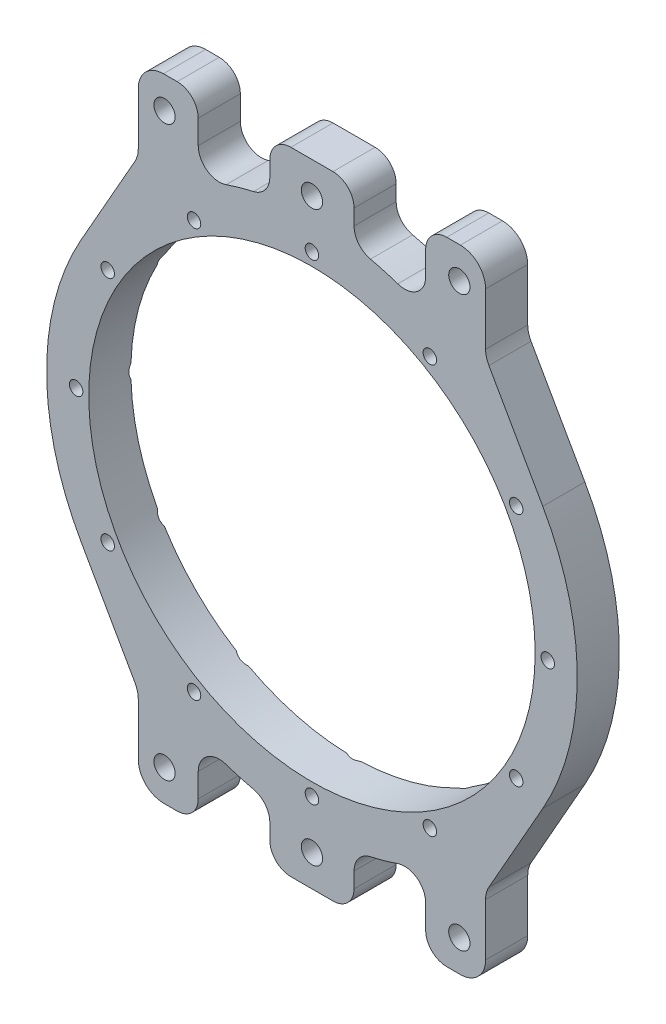
from build123d import *

# Parameters (mm, degrees)
SKETCH_1_R                   = 2.1
SKETCH_1_R_2                 = 1.6
SKETCH_1_R_3                 = 53
EXTRUDE_1_DEPTH              = 10
HOLE_WIZARD_M3_2_D           = 3.05
HOLE_WIZARD_M3_2_CSINK_D     = 6.94
HOLE_WIZARD_M3_2_CSINK_ANGLE = 90
SKETCH_7_R                   = 2.1
EXTRUDE_2_DEPTH              = 10
EXTRUDE_3_DEPTH              = 10
CUT_EXTRUDE_1_DEPTH          = 10
CUT_EXTRUDE_START            = -10
CUT_EXTRUDE_2_DEPTH          = 10
MIRROR_START                 = -10
MIRROR_4_COPY_1_DEPTH        = 10
SKETCH_11_R                  = 2.525
CUT_EXTRUDE_3_DEPTH          = 10
FILLET_1_R                   = 6
CUT_EXTRUDE_4_DEPTH          = 10
FILLET_2_R                   = 5


with BuildPart() as part:
    # 草图1 → 凸台-拉伸1 (new body)
    with BuildSketch(Plane.XY):
        with BuildLine():
            Line((-50.686796226, 46.913203774), (-59.711360377, 20.088639623))
            ThreePointArc((-59.711360377, 20.088639623), (-63, 0), (-59.711360377, -20.088639623))
            Line((-59.711360377, -20.088639623), (-50.686796226, -46.913203774))
            ThreePointArc((-50.686796226, -46.913203774), (-49.242640687, -49.242640687), (-46.913203774, -50.686796226))
            Line((-46.913203774, -50.686796226), (-20.088639623, -59.711360377))
            ThreePointArc((-20.088639623, -59.711360377), (0, -63), (20.088639623, -59.711360377))
            Line((20.088639623, -59.711360377), (46.913203774, -50.686796226))
            ThreePointArc((46.913203774, -50.686796226), (49.242640687, -49.242640687), (50.686796226, -46.913203774))
            Line((50.686796226, -46.913203774), (59.711360377, -20.088639623))
            ThreePointArc((59.711360377, -20.088639623), (63, 0), (59.711360377, 20.088639623))
            Line((59.711360377, 20.088639623), (50.686796226, 46.913203774))
            ThreePointArc((50.686796226, 46.913203774), (49.242640687, 49.242640687), (46.913203774, 50.686796226))
            Line((46.913203774, 50.686796226), (20.088639623, 59.711360377))
            ThreePointArc((20.088639623, 59.711360377), (0, 63), (-20.088639623, 59.711360377))
            Line((-20.088639623, 59.711360377), (-46.913203774, 50.686796226))
            ThreePointArc((-46.913203774, 50.686796226), (-49.242640687, 49.242640687), (-50.686796226, 46.913203774))
        make_face()
        with Locations((45, 45)):
            Circle(SKETCH_1_R, mode=Mode.SUBTRACT)
        with Locations((-45, 45)):
            Circle(SKETCH_1_R, mode=Mode.SUBTRACT)
        with Locations((-45, -45)):
            Circle(SKETCH_1_R, mode=Mode.SUBTRACT)
        with Locations((45, -45)):
            Circle(SKETCH_1_R, mode=Mode.SUBTRACT)
        with Locations((0, 56)):
            Circle(SKETCH_1_R_2, mode=Mode.SUBTRACT)
        with Locations((28, 48.497422612)):
            Circle(SKETCH_1_R_2, mode=Mode.SUBTRACT)
        with Locations((48.497422612, 28)):
            Circle(SKETCH_1_R_2, mode=Mode.SUBTRACT)
        with Locations((56, 0)):
            Circle(SKETCH_1_R_2, mode=Mode.SUBTRACT)
        with Locations((48.497422612, -28)):
            Circle(SKETCH_1_R_2, mode=Mode.SUBTRACT)
        with Locations((28, -48.497422612)):
            Circle(SKETCH_1_R_2, mode=Mode.SUBTRACT)
        with Locations((0, -56)):
            Circle(SKETCH_1_R_2, mode=Mode.SUBTRACT)
        with Locations((-28, -48.497422612)):
            Circle(SKETCH_1_R_2, mode=Mode.SUBTRACT)
        with Locations((-48.497422612, -28)):
            Circle(SKETCH_1_R_2, mode=Mode.SUBTRACT)
        with Locations((-56, 0)):
            Circle(SKETCH_1_R_2, mode=Mode.SUBTRACT)
        with Locations((-48.497422612, 28)):
            Circle(SKETCH_1_R_2, mode=Mode.SUBTRACT)
        with Locations((-28, 48.497422612)):
            Circle(SKETCH_1_R_2, mode=Mode.SUBTRACT)
        Circle(SKETCH_1_R_3, mode=Mode.SUBTRACT)
    extrude(amount=EXTRUDE_1_DEPTH)

    # M3 六角凹锥坑头螺钉的锥形沉头孔2 (through all)
    with Locations(Plane(origin=(0, 0, 0), x_dir=(-1, 0, 0), z_dir=(0, 0, -1))):
        with Locations((0, 56)):
            CounterSinkHole(HOLE_WIZARD_M3_2_D / 2, HOLE_WIZARD_M3_2_CSINK_D / 2, counter_sink_angle=HOLE_WIZARD_M3_2_CSINK_ANGLE)

    # 阵列(圆周)1: read off the stored shape, not the designer's step
    # 阵列(圆周)1: loft between two sections, ruled curve by curve
    pattern_circular_1_from = [
        Edge.make_three_point_arc((26.4, 48.497422612, 1.87), (28, 50.097422612, 1.87), (29.6, 48.497422612, 1.87)),
        Edge.make_three_point_arc((29.6, 48.497422612, 1.87), (28, 46.897422612, 1.87), (26.4, 48.497422612, 1.87)),
    ]
    pattern_circular_1_to = [
        Edge.make_three_point_arc((24.529999939, 48.497422612, -6.1e-08), (28, 51.967422673, -6.1e-08), (31.470000061, 48.497422612, -6.1e-08)),
        Edge.make_three_point_arc((31.470000061, 48.497422612, -6.1e-08), (28, 45.027422551, -6.1e-08), (24.529999939, 48.497422612, -6.1e-08)),
    ]
    pattern_circular_1 = Solid(Shell([*[Face.make_surface_from_curves(pattern_circular_1_from[k], pattern_circular_1_to[k]) for k in range(2)], Face(Wire(pattern_circular_1_from)), Face(Wire(pattern_circular_1_to))]))
    add(pattern_circular_1, mode=Mode.SUBTRACT)

    # Pattern Circular 1 2: loft between two sections, ruled curve by curve
    pattern_circular_1_2_from = [
        Edge.make_three_point_arc((46.897422612, 28, 1.87), (48.497422612, 29.6, 1.87), (50.097422612, 28, 1.87)),
        Edge.make_three_point_arc((50.097422612, 28, 1.87), (48.497422612, 26.4, 1.87), (46.897422612, 28, 1.87)),
    ]
    pattern_circular_1_2_to = [
        Edge.make_three_point_arc((45.027422551, 28, -6.1e-08), (48.497422612, 31.470000061, -6.1e-08), (51.967422673, 28, -6.1e-08)),
        Edge.make_three_point_arc((51.967422673, 28, -6.1e-08), (48.497422612, 24.529999939, -6.1e-08), (45.027422551, 28, -6.1e-08)),
    ]
    pattern_circular_1_2 = Solid(Shell([*[Face.make_surface_from_curves(pattern_circular_1_2_from[k], pattern_circular_1_2_to[k]) for k in range(2)], Face(Wire(pattern_circular_1_2_from)), Face(Wire(pattern_circular_1_2_to))]))
    add(pattern_circular_1_2, mode=Mode.SUBTRACT)

    # Pattern Circular 1 3: loft between two sections, ruled curve by curve
    pattern_circular_1_3_from = [
        Edge.make_three_point_arc((54.4, 0, 1.87), (56, 1.6, 1.87), (57.6, 0, 1.87)),
        Edge.make_three_point_arc((57.6, 0, 1.87), (56, -1.6, 1.87), (54.4, 0, 1.87)),
    ]
    pattern_circular_1_3_to = [
        Edge.make_three_point_arc((52.529999939, 0, -6.1e-08), (56, 3.470000061, -6.1e-08), (59.470000061, 0, -6.1e-08)),
        Edge.make_three_point_arc((59.470000061, 0, -6.1e-08), (56, -3.470000061, -6.1e-08), (52.529999939, 0, -6.1e-08)),
    ]
    pattern_circular_1_3 = Solid(Shell([*[Face.make_surface_from_curves(pattern_circular_1_3_from[k], pattern_circular_1_3_to[k]) for k in range(2)], Face(Wire(pattern_circular_1_3_from)), Face(Wire(pattern_circular_1_3_to))]))
    add(pattern_circular_1_3, mode=Mode.SUBTRACT)

    # Pattern Circular 1 4: loft between two sections, ruled curve by curve
    pattern_circular_1_4_from = [
        Edge.make_three_point_arc((46.897422612, -28, 1.87), (48.497422612, -26.4, 1.87), (50.097422612, -28, 1.87)),
        Edge.make_three_point_arc((50.097422612, -28, 1.87), (48.497422612, -29.6, 1.87), (46.897422612, -28, 1.87)),
    ]
    pattern_circular_1_4_to = [
        Edge.make_three_point_arc((45.027422551, -28, -6.1e-08), (48.497422612, -24.529999939, -6.1e-08), (51.967422673, -28, -6.1e-08)),
        Edge.make_three_point_arc((51.967422673, -28, -6.1e-08), (48.497422612, -31.470000061, -6.1e-08), (45.027422551, -28, -6.1e-08)),
    ]
    pattern_circular_1_4 = Solid(Shell([*[Face.make_surface_from_curves(pattern_circular_1_4_from[k], pattern_circular_1_4_to[k]) for k in range(2)], Face(Wire(pattern_circular_1_4_from)), Face(Wire(pattern_circular_1_4_to))]))
    add(pattern_circular_1_4, mode=Mode.SUBTRACT)

    # Pattern Circular 1 5: loft between two sections, ruled curve by curve
    pattern_circular_1_5_from = [
        Edge.make_three_point_arc((26.4, -48.497422612, 1.87), (28, -46.897422612, 1.87), (29.6, -48.497422612, 1.87)),
        Edge.make_three_point_arc((29.6, -48.497422612, 1.87), (28, -50.097422612, 1.87), (26.4, -48.497422612, 1.87)),
    ]
    pattern_circular_1_5_to = [
        Edge.make_three_point_arc((24.529999939, -48.497422612, -6.1e-08), (28, -45.027422551, -6.1e-08), (31.470000061, -48.497422612, -6.1e-08)),
        Edge.make_three_point_arc((31.470000061, -48.497422612, -6.1e-08), (28, -51.967422673, -6.1e-08), (24.529999939, -48.497422612, -6.1e-08)),
    ]
    pattern_circular_1_5 = Solid(Shell([*[Face.make_surface_from_curves(pattern_circular_1_5_from[k], pattern_circular_1_5_to[k]) for k in range(2)], Face(Wire(pattern_circular_1_5_from)), Face(Wire(pattern_circular_1_5_to))]))
    add(pattern_circular_1_5, mode=Mode.SUBTRACT)

    # Pattern Circular 1 6: loft between two sections, ruled curve by curve
    pattern_circular_1_6_from = [
        Edge.make_three_point_arc((-1.6, -56, 1.87), (0, -54.4, 1.87), (1.6, -56, 1.87)),
        Edge.make_three_point_arc((1.6, -56, 1.87), (0, -57.6, 1.87), (-1.6, -56, 1.87)),
    ]
    pattern_circular_1_6_to = [
        Edge.make_three_point_arc((-3.470000061, -56, -6.1e-08), (0, -52.529999939, -6.1e-08), (3.470000061, -56, -6.1e-08)),
        Edge.make_three_point_arc((3.470000061, -56, -6.1e-08), (0, -59.470000061, -6.1e-08), (-3.470000061, -56, -6.1e-08)),
    ]
    pattern_circular_1_6 = Solid(Shell([*[Face.make_surface_from_curves(pattern_circular_1_6_from[k], pattern_circular_1_6_to[k]) for k in range(2)], Face(Wire(pattern_circular_1_6_from)), Face(Wire(pattern_circular_1_6_to))]))
    add(pattern_circular_1_6, mode=Mode.SUBTRACT)

    # Pattern Circular 1 7: loft between two sections, ruled curve by curve
    pattern_circular_1_7_from = [
        Edge.make_three_point_arc((-29.6, -48.497422612, 1.87), (-28, -46.897422612, 1.87), (-26.4, -48.497422612, 1.87)),
        Edge.make_three_point_arc((-26.4, -48.497422612, 1.87), (-28, -50.097422612, 1.87), (-29.6, -48.497422612, 1.87)),
    ]
    pattern_circular_1_7_to = [
        Edge.make_three_point_arc((-31.470000061, -48.497422612, -6.1e-08), (-28, -45.027422551, -6.1e-08), (-24.529999939, -48.497422612, -6.1e-08)),
        Edge.make_three_point_arc((-24.529999939, -48.497422612, -6.1e-08), (-28, -51.967422673, -6.1e-08), (-31.470000061, -48.497422612, -6.1e-08)),
    ]
    pattern_circular_1_7 = Solid(Shell([*[Face.make_surface_from_curves(pattern_circular_1_7_from[k], pattern_circular_1_7_to[k]) for k in range(2)], Face(Wire(pattern_circular_1_7_from)), Face(Wire(pattern_circular_1_7_to))]))
    add(pattern_circular_1_7, mode=Mode.SUBTRACT)

    # Pattern Circular 1 8: loft between two sections, ruled curve by curve
    pattern_circular_1_8_from = [
        Edge.make_three_point_arc((-50.097422612, -28, 1.87), (-48.497422612, -26.4, 1.87), (-46.897422612, -28, 1.87)),
        Edge.make_three_point_arc((-46.897422612, -28, 1.87), (-48.497422612, -29.6, 1.87), (-50.097422612, -28, 1.87)),
    ]
    pattern_circular_1_8_to = [
        Edge.make_three_point_arc((-51.967422673, -28, -6.1e-08), (-48.497422612, -24.529999939, -6.1e-08), (-45.027422551, -28, -6.1e-08)),
        Edge.make_three_point_arc((-45.027422551, -28, -6.1e-08), (-48.497422612, -31.470000061, -6.1e-08), (-51.967422673, -28, -6.1e-08)),
    ]
    pattern_circular_1_8 = Solid(Shell([*[Face.make_surface_from_curves(pattern_circular_1_8_from[k], pattern_circular_1_8_to[k]) for k in range(2)], Face(Wire(pattern_circular_1_8_from)), Face(Wire(pattern_circular_1_8_to))]))
    add(pattern_circular_1_8, mode=Mode.SUBTRACT)

    # Pattern Circular 1 9: loft between two sections, ruled curve by curve
    pattern_circular_1_9_from = [
        Edge.make_three_point_arc((-57.6, 0, 1.87), (-56, 1.6, 1.87), (-54.4, 0, 1.87)),
        Edge.make_three_point_arc((-54.4, 0, 1.87), (-56, -1.6, 1.87), (-57.6, 0, 1.87)),
    ]
    pattern_circular_1_9_to = [
        Edge.make_three_point_arc((-59.470000061, 0, -6.1e-08), (-56, 3.470000061, -6.1e-08), (-52.529999939, 0, -6.1e-08)),
        Edge.make_three_point_arc((-52.529999939, 0, -6.1e-08), (-56, -3.470000061, -6.1e-08), (-59.470000061, 0, -6.1e-08)),
    ]
    pattern_circular_1_9 = Solid(Shell([*[Face.make_surface_from_curves(pattern_circular_1_9_from[k], pattern_circular_1_9_to[k]) for k in range(2)], Face(Wire(pattern_circular_1_9_from)), Face(Wire(pattern_circular_1_9_to))]))
    add(pattern_circular_1_9, mode=Mode.SUBTRACT)

    # Pattern Circular 1 10: loft between two sections, ruled curve by curve
    pattern_circular_1_10_from = [
        Edge.make_three_point_arc((-50.097422612, 28, 1.87), (-48.497422612, 29.6, 1.87), (-46.897422612, 28, 1.87)),
        Edge.make_three_point_arc((-46.897422612, 28, 1.87), (-48.497422612, 26.4, 1.87), (-50.097422612, 28, 1.87)),
    ]
    pattern_circular_1_10_to = [
        Edge.make_three_point_arc((-51.967422673, 28, -6.1e-08), (-48.497422612, 31.470000061, -6.1e-08), (-45.027422551, 28, -6.1e-08)),
        Edge.make_three_point_arc((-45.027422551, 28, -6.1e-08), (-48.497422612, 24.529999939, -6.1e-08), (-51.967422673, 28, -6.1e-08)),
    ]
    pattern_circular_1_10 = Solid(Shell([*[Face.make_surface_from_curves(pattern_circular_1_10_from[k], pattern_circular_1_10_to[k]) for k in range(2)], Face(Wire(pattern_circular_1_10_from)), Face(Wire(pattern_circular_1_10_to))]))
    add(pattern_circular_1_10, mode=Mode.SUBTRACT)

    # Pattern Circular 1 11: loft between two sections, ruled curve by curve
    pattern_circular_1_11_from = [
        Edge.make_three_point_arc((-29.6, 48.497422612, 1.87), (-28, 50.097422612, 1.87), (-26.4, 48.497422612, 1.87)),
        Edge.make_three_point_arc((-26.4, 48.497422612, 1.87), (-28, 46.897422612, 1.87), (-29.6, 48.497422612, 1.87)),
    ]
    pattern_circular_1_11_to = [
        Edge.make_three_point_arc((-31.470000061, 48.497422612, -6.1e-08), (-28, 51.967422673, -6.1e-08), (-24.529999939, 48.497422612, -6.1e-08)),
        Edge.make_three_point_arc((-24.529999939, 48.497422612, -6.1e-08), (-28, 45.027422551, -6.1e-08), (-31.470000061, 48.497422612, -6.1e-08)),
    ]
    pattern_circular_1_11 = Solid(Shell([*[Face.make_surface_from_curves(pattern_circular_1_11_from[k], pattern_circular_1_11_to[k]) for k in range(2)], Face(Wire(pattern_circular_1_11_from)), Face(Wire(pattern_circular_1_11_to))]))
    add(pattern_circular_1_11, mode=Mode.SUBTRACT)

    # 草图7 → 凸台-拉伸2 (add)
    with BuildSketch(Plane(origin=(0, 0, 0), x_dir=(-1, 0, 0), z_dir=(0, 0, -1))):
        with Locations((45, -45)):
            Circle(SKETCH_7_R)
        with Locations((-45, -45)):
            Circle(SKETCH_7_R)
        with Locations((-45, 45)):
            Circle(SKETCH_7_R)
        with Locations((45, 45)):
            Circle(SKETCH_7_R)
    extrude(amount=-EXTRUDE_2_DEPTH)

    # 草图8 → 凸台-拉伸3 (add)
    with BuildSketch(Plane.XY.offset(10)):
        Polygon((-50.686796226, 46.913203774), (-50.686796226, 75), (50.686796226, 75), (50.686796226, 46.913203774), (0, 63), align=None)
    extrude_3 = extrude(amount=-EXTRUDE_3_DEPTH)

    # 镜向1: 凸台-拉伸3 across plane
    add(extrude_3.mirror(Plane.ZX))

    # 草图9 → 切除-拉伸1 (cut)
    with BuildSketch(Plane.XY.offset(10)):
        Polygon((-50.686796226, 46.913203774), (-41.237580466, 75), (-50.686796226, 75), align=None)
        Polygon((50.686796226, 75), (50.686796226, 46.913203774), (41.237580466, 75), align=None)
    cut_extrude_1 = extrude(amount=-CUT_EXTRUDE_1_DEPTH, mode=Mode.SUBTRACT)

    # 镜向2: 切除-拉伸1 across plane
    add(cut_extrude_1.mirror(Plane.ZX), mode=Mode.SUBTRACT)

    # 草图10 → 切除-拉伸2 (cut)
    with BuildSketch(Plane.XY.offset(10).offset(CUT_EXTRUDE_START)):
        with BuildLine():
            Line((41.237580466, 75), (41.237580466, 55))
            Line((41.237580466, 55), (54.803833869, 31.0731362))
            ThreePointArc((54.803833869, 31.0731362), (57.520406984, 25.698303065), (59.711360377, 20.088639623))
            Line((59.711360377, 20.088639623), (41.237580466, 75))
        make_face()
    cut_extrude_2 = extrude(amount=CUT_EXTRUDE_2_DEPTH, mode=Mode.SUBTRACT)

    # 镜向3: 切除-拉伸2 across plane
    add(cut_extrude_2.mirror(Plane(origin=(0, 0, 0), x_dir=(0, 0, 1), z_dir=(1, 0, 0))), mode=Mode.SUBTRACT)

    # 镜向4: 切除-拉伸2 across plane
    add(cut_extrude_2.mirror(Plane.ZX), mode=Mode.SUBTRACT)

    # 镜向4 copy 1 sketch → 镜向4 copy 1 (cut)
    with BuildSketch(Plane(origin=(0, 0, 10), x_dir=(-1, 0, 0), z_dir=(0, 0, 1)).offset(MIRROR_START)):
        with BuildLine():
            Line((41.237580466, 75), (41.237580466, 55))
            Line((41.237580466, 55), (54.803833869, 31.0731362))
            ThreePointArc((54.803833869, 31.0731362), (57.520406984, 25.698303065), (59.711360377, 20.088639623))
            Line((59.711360377, 20.088639623), (41.237580466, 75))
        make_face()
    extrude(amount=MIRROR_4_COPY_1_DEPTH, mode=Mode.SUBTRACT)

    # 草图11 → 切除-拉伸3 (cut)
    with BuildSketch(Plane.XY.offset(10)):
        with Locations((35, 67.5)):
            Circle(SKETCH_11_R)
        with Locations((0, 67.5)):
            Circle(SKETCH_11_R)
        with Locations((-35, 67.5)):
            Circle(SKETCH_11_R)
    cut_extrude_3 = extrude(amount=-CUT_EXTRUDE_3_DEPTH, mode=Mode.SUBTRACT)

    # 镜向5: 切除-拉伸3 across plane
    add(cut_extrude_3.mirror(Plane.ZX), mode=Mode.SUBTRACT)

    # 圆角1
    fillet_1_edges = [part.edges().sort_by_distance(p)[0] for p in [
        (-41.237580466, 75, 5),
        (41.237580466, 75, 5),
        (-41.237580466, -75, 5),
        (41.237580466, -75, 5),
        (41.237580466, 55, 5),
        (-41.237580466, 55, 5),
        (-41.237580466, -55, 5),
        (41.237580466, -55, 5),
    ]]
    fillet(fillet_1_edges, radius=FILLET_1_R)

    # 草图12 → 切除-拉伸4 (cut)
    with BuildSketch(Plane(origin=(0, 0, 0), x_dir=(-1, 0, 0), z_dir=(0, 0, -1))):
        with BuildLine():
            Line((-27, 75), (-27, 56.920997883))
            ThreePointArc((-27, 56.920997883), (-18.68743859, 60.164604536), (-10, 62.20128616))
            Line((-10, 62.20128616), (-10, 75))
            Line((-10, 75), (-27, 75))
        make_face()
        with BuildLine():
            Line((27, 75), (10, 75))
            Line((10, 75), (10, 62.20128616))
            ThreePointArc((10, 62.20128616), (18.68743859, 60.164604536), (27, 56.920997883))
            Line((27, 56.920997883), (27, 75))
        make_face()
    cut_extrude_4 = extrude(amount=-CUT_EXTRUDE_4_DEPTH, mode=Mode.SUBTRACT)

    # 镜向6: 切除-拉伸4 across plane
    add(cut_extrude_4.mirror(Plane.ZX), mode=Mode.SUBTRACT)

    # 圆角2
    fillet_2_edges = [part.edges().sort_by_distance(p)[0] for p in [
        (27, 56.920997883, 5),
        (10, 62.20128616, 5),
        (10, 75, 5),
        (27, 75, 5),
        (-27, 75, 5),
        (-10, 75, 5),
        (-10, 62.20128616, 5),
        (-27, 56.920997883, 5),
        (10, -75, 5),
        (27, -75, 5),
        (27, -56.920997883, 5),
        (10, -62.20128616, 5),
        (-10, -62.20128616, 5),
        (-27, -56.920997883, 5),
        (-27, -75, 5),
        (-10, -75, 5),
    ]]
    fillet(fillet_2_edges, radius=FILLET_2_R)


solid = part.part
